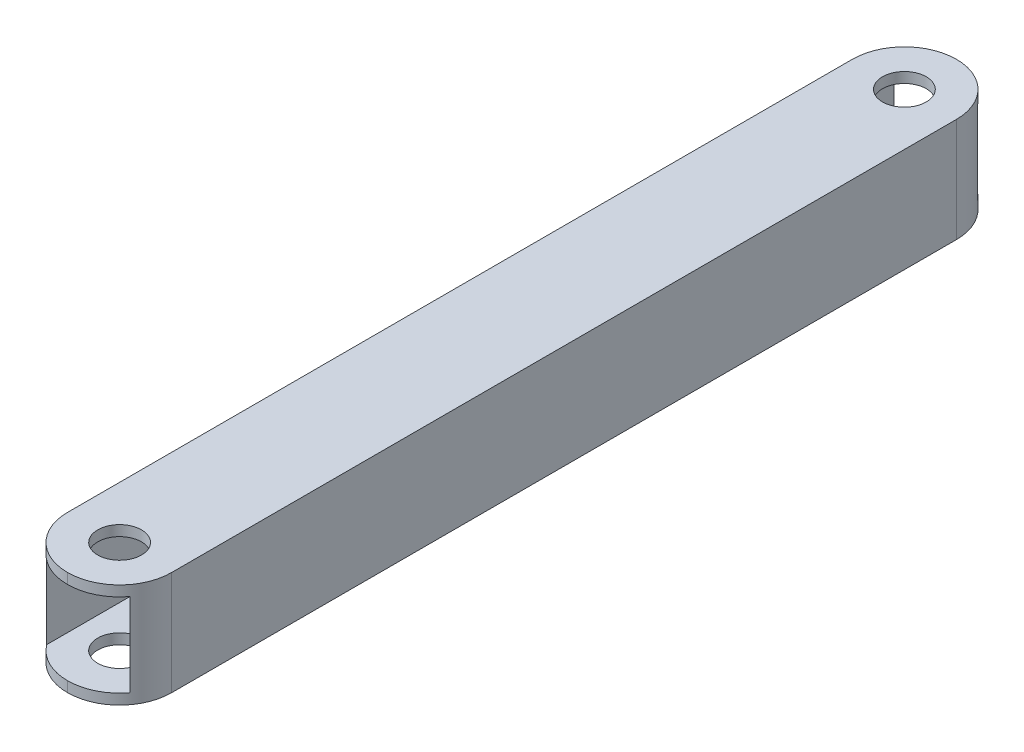
from build123d import *

# Parameters (mm, degrees)
SKETCH_1_W          = 10
SKETCH_1_H          = 10
SKETCH_1_W_2        = 8
SKETCH_1_H_2        = 8
EXTRUDE_1_DEPTH     = 85.374067158
SKETCH_2_R          = 2.1
CUT_EXTRUDE_1_DEPTH = 40
FILLET_1_R          = 5


with BuildPart() as part:
    # ｽｹｯﾁ1 → ﾎﾞｽ - 押し出し1 (new body)
    with BuildSketch(Plane.XY):
        Rectangle(SKETCH_1_W, SKETCH_1_H)
        Rectangle(SKETCH_1_W_2, SKETCH_1_H_2, mode=Mode.SUBTRACT)
    extrude(amount=EXTRUDE_1_DEPTH)

    # ｽｹｯﾁ2 → ｶｯﾄ - 押し出し1 (cut)
    with BuildSketch(Plane(origin=(0, 5, 0), x_dir=(1, 0, 0), z_dir=(0, 1, 0))):
        with Locations(Location((0, -5, 0), (0, 0, 270))):
            Circle(SKETCH_2_R)
        with Locations(Location((0, -80.374067158, 0), (0, 0, 270))):
            Circle(SKETCH_2_R)
    extrude(amount=-CUT_EXTRUDE_1_DEPTH, mode=Mode.SUBTRACT)

    # ﾌｨﾚｯﾄ1
    # the kernel refuses this fillet: 5 mm, written as the material it takes off along each edge
    with BuildSketch(Plane(origin=(5, 17.5, 85.374067158), x_dir=(-1, 0, 0), z_dir=(0, -1, 0)), Plane(origin=(-5, -17.5, 0), x_dir=(0, 0, 1), z_dir=(0, 1, 0))) as fillet_1_piece_1:
        with BuildLine():
            CenterArc((FILLET_1_R, FILLET_1_R), FILLET_1_R, 180, 90)
            Line((0, FILLET_1_R), (0, 0))
            Line((0, 0), (FILLET_1_R, 0))
        make_face()
    extrude(amount=35, mode=Mode.SUBTRACT)
    with BuildSketch(Plane(origin=(-5, -17.5, 85.374067158), x_dir=(0, 0, -1), z_dir=(0, 1, 0)), Plane(origin=(5, 17.5, 0), x_dir=(-1, 0, 0), z_dir=(0, -1, 0))) as fillet_1_piece_2:
        with BuildLine():
            CenterArc((FILLET_1_R, -FILLET_1_R), FILLET_1_R, 90, 90)
            Line((0, -FILLET_1_R), (0, 0))
            Line((0, 0), (FILLET_1_R, 0))
        make_face()
    extrude(amount=35, mode=Mode.SUBTRACT)


solid = part.part
